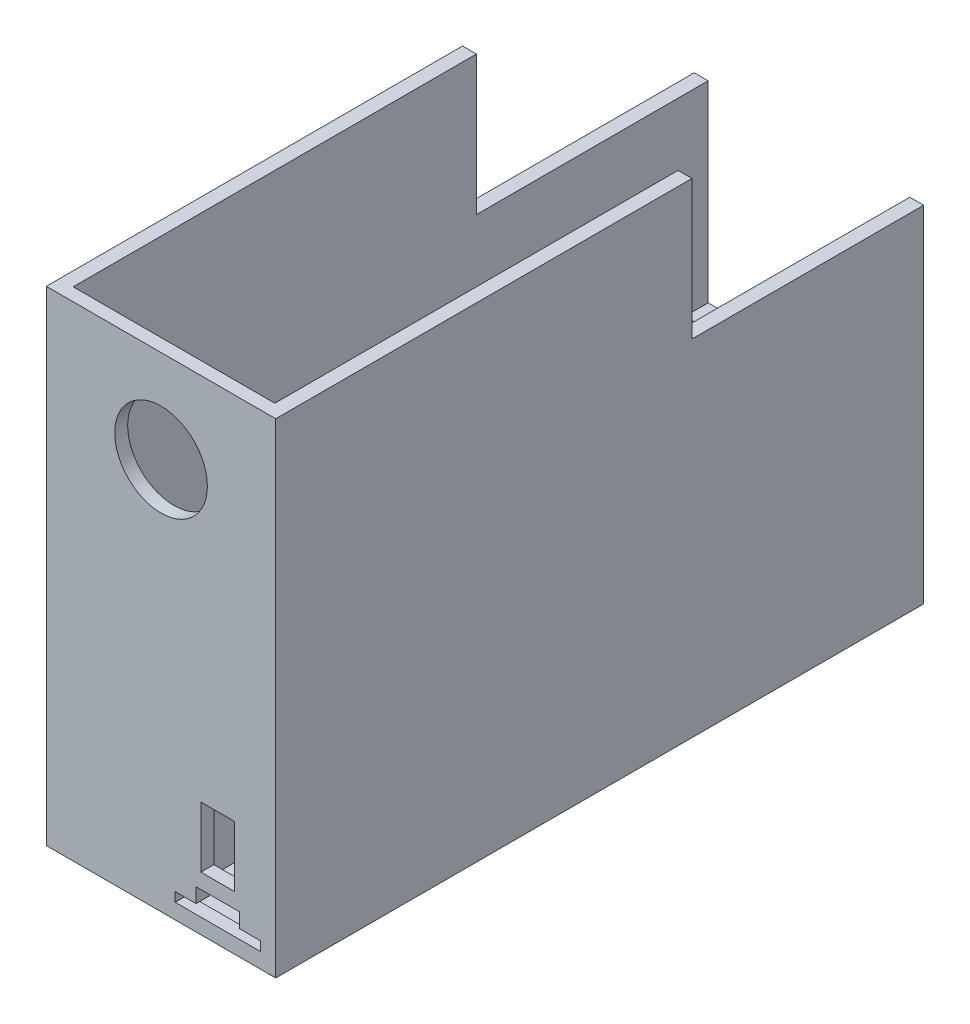
from build123d import *

# Parameters (mm, degrees)
ESQUISSE1_W                   = 49.5
ESQUISSE1_H                   = 104.5
BOSS_EXTRU_1_DEPTH            = 139.8
COQUE1_T                      = -3
ENL_V_MAT_EXTRU_1_REACH       = 159.24
ESQUISSE2_W                   = 50
ESQUISSE2_H                   = 30
ESQUISSE3_W                   = 43.5
ESQUISSE3_H                   = 30
BOSS_EXTRU_2_DEPTH            = 2
ENL_V_MAT_EXTRU_2_REACH       = 153.283
ESQUISSE5_R                   = 10
ENL_V_MAT_EXTRU_3_REACH       = 150.516
ESQUISSE6_W                   = 43.5
ESQUISSE6_H                   = 41.5
ENL_V_MAT_EXTRU_4_REACH       = 153.283
ESQUISSE7_W                   = 6.9
ESQUISSE7_H                   = 12.7
D_PLACER_START                = 136.8
D_PLACER_LA_FACE1_OUTLINE_W   = 43.5
D_PLACER_LA_FACE1_OUTLINE_H   = 101.5
D_PLACER_LA_FACE1_OUTLINE_W_2 = 6.9
D_PLACER_LA_FACE1_OUTLINE_H_2 = 12.7
D_PLACER_LA_FACE1_OUTLINE_R   = 10
D_PLACER_LA_FACE1_DEPTH       = 0.2
D_PLACER_START_2              = 137
D_PLACER_LA_FACE1_2_DEPTH     = 2.8
ENL_V_MAT_EXTRU_5_REACH       = 176.525
ESQUISSE8_R                   = 1.2
D_PLACER_START_3              = 8.6
D_PLACER_LA_FACE2_OUTLINE_W   = 13.1
D_PLACER_LA_FACE2_OUTLINE_H   = 2.8
D_PLACER_LA_FACE2_DEPTH       = 7.3
BOSS_EXTRU_3_DEPTH            = 55
ESQUISSE10_R                  = 3.2
BOSS_EXTRU_4_DEPTH            = 2.5
ENL_V_MAT_EXTRU_6_DEPTH       = 152.283393008
ENL_V_MAT_EXTRU_6_DEPTH_BACK  = 1.22
ESQUISSE12_R                  = 4.05
ENL_V_MAT_EXTRU_7_REACH       = 175.083
ESQUISSE13_R                  = 1.2
ESQUISSE14_R                  = 2.5
ENL_V_MAT_EXTRU_8_DEPTH       = 3


# Read off the part's stored shape, not the designer's step: Déplacer la face1, Déplacer la face2
with BuildPart() as part:
    # Esquisse1 → Boss.-Extru.1 (new body)
    with BuildSketch(Plane.XY):
        Rectangle(ESQUISSE1_W, ESQUISSE1_H)
    extrude(amount=BOSS_EXTRU_1_DEPTH)

    # Coque1
    coque1_openings = [part.faces().sort_by_distance(p)[0] for p in [
        (0, 52.25, 69.9),
    ]]
    offset(amount=COQUE1_T, openings=coque1_openings, kind=Kind.INTERSECTION)

    # Esquisse2 → Enlèv. mat.-Extru.1 (cut, up to next)
    with BuildSketch(Plane(origin=(24.75, 0, 0), x_dir=(0, 0, -1), z_dir=(1, 0, 0)), mode=Mode.PRIVATE) as enl_v_mat_extru_1_sk1:
        with Locations((-25, 37.25)):
            Rectangle(ESQUISSE2_W, ESQUISSE2_H)
    enl_v_mat_extru_1_tool1 = extrude(enl_v_mat_extru_1_sk1.sketch, amount=-ENL_V_MAT_EXTRU_1_REACH, mode=Mode.PRIVATE) & part.part
    add(enl_v_mat_extru_1_tool1.solids().sort_by_distance((24.75, 37.25, 25))[0], mode=Mode.SUBTRACT)

    # Esquisse3 → Boss.-Extru.2 (add)
    with BuildSketch(Plane.XY.offset(3)):
        with Locations((0, -34.25)):
            Rectangle(ESQUISSE3_W, ESQUISSE3_H)
    extrude(amount=BOSS_EXTRU_2_DEPTH)

    # Esquisse5 → Enlèv. mat.-Extru.2 (cut, up to next)
    with BuildSketch(Plane.XY.offset(139.8), mode=Mode.PRIVATE) as enl_v_mat_extru_2_sk1:
        with Locations((0, 32.25)):
            Circle(ESQUISSE5_R)
    enl_v_mat_extru_2_tool1 = extrude(enl_v_mat_extru_2_sk1.sketch, amount=-ENL_V_MAT_EXTRU_2_REACH, mode=Mode.PRIVATE) & part.part
    add(enl_v_mat_extru_2_tool1.solids().sort_by_distance((0, 32.25, 139.8))[0], mode=Mode.SUBTRACT)

    # Esquisse6 → Enlèv. mat.-Extru.3 (cut, up to next)
    with BuildSketch(Plane.XY.offset(3), mode=Mode.PRIVATE) as enl_v_mat_extru_3_sk1:
        with Locations((0, 1.5)):
            Rectangle(ESQUISSE6_W, ESQUISSE6_H)
    enl_v_mat_extru_3_tool1 = extrude(enl_v_mat_extru_3_sk1.sketch, amount=-ENL_V_MAT_EXTRU_3_REACH, mode=Mode.PRIVATE) & part.part
    add(enl_v_mat_extru_3_tool1.solids().sort_by_distance((0, 1.5, 3))[0], mode=Mode.SUBTRACT)

    # Esquisse7 → Enlèv. mat.-Extru.4 (cut, up to next)
    with BuildSketch(Plane.XY.offset(139.8), mode=Mode.PRIVATE) as enl_v_mat_extru_4_sk1:
        Polygon((16.75, -47.15), (21.25, -47.15), (21.25, -48.75), (3.25, -48.75), (3.25, -47.15), (7.75, -47.15), (7.75, -43.99), (16.75, -43.99), align=None)
    enl_v_mat_extru_4_tool1 = extrude(enl_v_mat_extru_4_sk1.sketch, amount=-ENL_V_MAT_EXTRU_4_REACH, mode=Mode.PRIVATE) & part.part
    # Esquisse7 → Enlèv. mat.-Extru.4 (cut, up to next)
    with BuildSketch(Plane.XY.offset(139.8), mode=Mode.PRIVATE) as enl_v_mat_extru_4_sk2:
        with Locations((12.25, -33.99)):
            Rectangle(ESQUISSE7_W, ESQUISSE7_H)
    enl_v_mat_extru_4_tool2 = extrude(enl_v_mat_extru_4_sk2.sketch, amount=-ENL_V_MAT_EXTRU_4_REACH, mode=Mode.PRIVATE) & part.part
    add(enl_v_mat_extru_4_tool1.solids().sort_by_distance((12.25, -46.767484, 139.8))[0], mode=Mode.SUBTRACT)
    add(enl_v_mat_extru_4_tool2.solids().sort_by_distance((12.25, -33.99, 139.8))[0], mode=Mode.SUBTRACT)

    # Déplacer la face1 outline → Déplacer la face1 (cut)
    with BuildSketch(Plane.XY.offset(D_PLACER_START)):
        with Locations((0, 1.5)):
            Rectangle(D_PLACER_LA_FACE1_OUTLINE_W, D_PLACER_LA_FACE1_OUTLINE_H)
        Polygon((16.75, -43.99), (16.75, -47.15), (21.25, -47.15), (21.25, -48.75), (3.25, -48.75), (3.25, -47.15), (7.75, -47.15), (7.75, -43.99), align=None, mode=Mode.SUBTRACT)
        with Locations((12.25, -33.99)):
            Rectangle(D_PLACER_LA_FACE1_OUTLINE_W_2, D_PLACER_LA_FACE1_OUTLINE_H_2, mode=Mode.SUBTRACT)
        with Locations((0, 32.25)):
            Circle(D_PLACER_LA_FACE1_OUTLINE_R, mode=Mode.SUBTRACT)
    extrude(amount=D_PLACER_LA_FACE1_DEPTH, mode=Mode.SUBTRACT)

    # D_placer la face1 2 outline → D_placer la face1 2 (cut)
    with BuildSketch(Plane.XY.offset(D_PLACER_START_2)):
        Polygon((21.45, -46.95), (16.95, -46.95), (16.95, -43.79), (7.55, -43.79), (7.55, -46.95), (3.05, -46.95), (3.05, -48.95), (21.45, -48.95), align=None)
        Polygon((16.75, -43.99), (16.75, -47.15), (21.25, -47.15), (21.25, -48.75), (3.25, -48.75), (3.25, -47.15), (7.75, -47.15), (7.75, -43.99), align=None, mode=Mode.SUBTRACT)
    extrude(amount=D_PLACER_LA_FACE1_2_DEPTH, mode=Mode.SUBTRACT)

    # Esquisse8 → Enlèv. mat.-Extru.5 (cut, up to next)
    with BuildSketch(Plane(origin=(0, -49.25, 0), x_dir=(1, 0, 0), z_dir=(0, 1, 0)), mode=Mode.PRIVATE) as enl_v_mat_extru_5_sk1:
        with Locations(Location((19.25, -104.8, 0), (0, 0, 270))):
            Circle(ESQUISSE8_R)
    enl_v_mat_extru_5_tool1 = extrude(enl_v_mat_extru_5_sk1.sketch, amount=-ENL_V_MAT_EXTRU_5_REACH, mode=Mode.PRIVATE) & part.part
    # Esquisse8 → Enlèv. mat.-Extru.5 (cut, up to next)
    with BuildSketch(Plane(origin=(0, -49.25, 0), x_dir=(1, 0, 0), z_dir=(0, 1, 0)), mode=Mode.PRIVATE) as enl_v_mat_extru_5_sk2:
        with Locations(Location((5.25, -104.8, 0), (0, 0, 270))):
            Circle(ESQUISSE8_R)
    enl_v_mat_extru_5_tool2 = extrude(enl_v_mat_extru_5_sk2.sketch, amount=-ENL_V_MAT_EXTRU_5_REACH, mode=Mode.PRIVATE) & part.part
    add(enl_v_mat_extru_5_tool1.solids().sort_by_distance((19.25, -49.25, 104.8))[0], mode=Mode.SUBTRACT)
    add(enl_v_mat_extru_5_tool2.solids().sort_by_distance((5.25, -49.25, 104.8))[0], mode=Mode.SUBTRACT)

    # Déplacer la face2 outline → Déplacer la face2 (cut)
    with BuildSketch(Plane.YZ.offset(D_PLACER_START_3)):
        with Locations((-33.99, 138.4)):
            Rectangle(D_PLACER_LA_FACE2_OUTLINE_W, D_PLACER_LA_FACE2_OUTLINE_H)
    extrude(amount=D_PLACER_LA_FACE2_DEPTH, mode=Mode.SUBTRACT)

    # Esquisse9 → Boss.-Extru.3 (add)
    with BuildSketch(Plane(origin=(0, -49.25, 0), x_dir=(1, 0, 0), z_dir=(0, 1, 0))):
        Polygon((-0.25, -137), (-0.25, -77), (-21.75, -77), (-21.75, -75), (1.75, -75), (1.75, -137), align=None)
    extrude(amount=BOSS_EXTRU_3_DEPTH)

    # Esquisse10 → Boss.-Extru.4 (add)
    with BuildSketch(Plane(origin=(0, -49.25, 0), x_dir=(1, 0, 0), z_dir=(0, 1, 0))):
        with Locations(Location((14.000000445, -70.185602769, 0), (0, 0, 270))):
            Circle(ESQUISSE10_R)
        with Locations(Location((-13.999998962, -70.191367017, 0), (0, 0, 270))):
            Circle(ESQUISSE10_R)
        with Locations(Location((14.187545547, -9.685562878, 0), (0, 0, 270))):
            Circle(ESQUISSE10_R)
        with Locations(Location((-14.012453855, -9.691368299, 0), (0, 0, 270))):
            Circle(ESQUISSE10_R)
    extrude(amount=BOSS_EXTRU_4_DEPTH)

    # Esquisse12 → Enlèv. mat.-Extru.6 (cut, two sides: drawn at the far end of the back side and taken through both)
    with BuildSketch(Plane(origin=(0, 0, 0), x_dir=(-1, 0, 0), z_dir=(0, 0, -1)).offset(-ENL_V_MAT_EXTRU_6_DEPTH_BACK)):
        with Locations(Location((0, -27.5, 0), (0, 0, 180))):
            Circle(ESQUISSE12_R)
    extrude(amount=ENL_V_MAT_EXTRU_6_DEPTH + ENL_V_MAT_EXTRU_6_DEPTH_BACK, mode=Mode.SUBTRACT)

    # Esquisse13 → Enlèv. mat.-Extru.7 (cut, up to next)
    with BuildSketch(Plane(origin=(0, -46.75, 0), x_dir=(1, 0, 0), z_dir=(0, 1, 0)), mode=Mode.PRIVATE) as enl_v_mat_extru_7_sk1:
        with Locations(Location((14.187545547, -9.685562878, 0), (0, 0, 270))):
            Circle(ESQUISSE13_R)
    enl_v_mat_extru_7_tool1 = extrude(enl_v_mat_extru_7_sk1.sketch, amount=-ENL_V_MAT_EXTRU_7_REACH, mode=Mode.PRIVATE) & part.part
    # Esquisse13 → Enlèv. mat.-Extru.7 (cut, up to next)
    with BuildSketch(Plane(origin=(0, -46.75, 0), x_dir=(1, 0, 0), z_dir=(0, 1, 0)), mode=Mode.PRIVATE) as enl_v_mat_extru_7_sk2:
        with Locations(Location((-14.012453855, -9.691368299, 0), (0, 0, 270))):
            Circle(ESQUISSE13_R)
    enl_v_mat_extru_7_tool2 = extrude(enl_v_mat_extru_7_sk2.sketch, amount=-ENL_V_MAT_EXTRU_7_REACH, mode=Mode.PRIVATE) & part.part
    # Esquisse13 → Enlèv. mat.-Extru.7 (cut, up to next)
    with BuildSketch(Plane(origin=(0, -46.75, 0), x_dir=(1, 0, 0), z_dir=(0, 1, 0)), mode=Mode.PRIVATE) as enl_v_mat_extru_7_sk3:
        with Locations(Location((-13.999998962, -70.191367017, 0), (0, 0, 270))):
            Circle(ESQUISSE13_R)
    enl_v_mat_extru_7_tool3 = extrude(enl_v_mat_extru_7_sk3.sketch, amount=-ENL_V_MAT_EXTRU_7_REACH, mode=Mode.PRIVATE) & part.part
    # Esquisse13 → Enlèv. mat.-Extru.7 (cut, up to next)
    with BuildSketch(Plane(origin=(0, -46.75, 0), x_dir=(1, 0, 0), z_dir=(0, 1, 0)), mode=Mode.PRIVATE) as enl_v_mat_extru_7_sk4:
        with Locations(Location((14.000000445, -70.185602769, 0), (0, 0, 270))):
            Circle(ESQUISSE13_R)
    enl_v_mat_extru_7_tool4 = extrude(enl_v_mat_extru_7_sk4.sketch, amount=-ENL_V_MAT_EXTRU_7_REACH, mode=Mode.PRIVATE) & part.part
    add(enl_v_mat_extru_7_tool1.solids().sort_by_distance((14.187546, -46.75, 9.685563))[0], mode=Mode.SUBTRACT)
    add(enl_v_mat_extru_7_tool2.solids().sort_by_distance((-14.012454, -46.75, 9.691368))[0], mode=Mode.SUBTRACT)
    add(enl_v_mat_extru_7_tool3.solids().sort_by_distance((-13.999999, -46.75, 70.191367))[0], mode=Mode.SUBTRACT)
    add(enl_v_mat_extru_7_tool4.solids().sort_by_distance((14, -46.75, 70.185603))[0], mode=Mode.SUBTRACT)

    # Esquisse14 → Enlèv. mat.-Extru.8 (cut)
    with BuildSketch(Plane.XZ.offset(52.25)):
        with Locations(Location((14.187545547, 9.685562878, 0), (0, 0, 270))):
            Circle(ESQUISSE14_R)
        with Locations(Location((-14.012453855, 9.691368299, 0), (0, 0, 270))):
            Circle(ESQUISSE14_R)
        with Locations(Location((-13.999998962, 70.191367017, 0), (0, 0, 270))):
            Circle(ESQUISSE14_R)
        with Locations(Location((14.000000445, 70.185602769, 0), (0, 0, 270))):
            Circle(ESQUISSE14_R)
    extrude(amount=-ENL_V_MAT_EXTRU_8_DEPTH, mode=Mode.SUBTRACT)


solid = part.part
